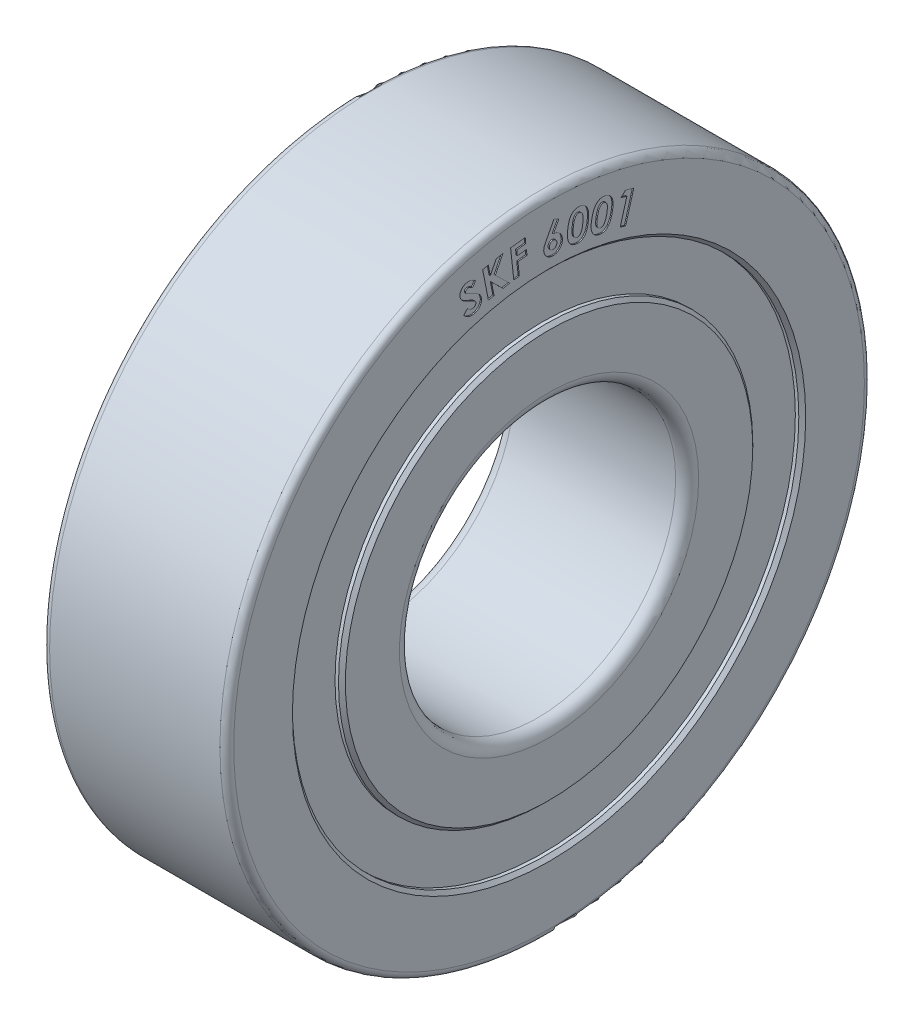
from build123d import *

# Parameters (mm, degrees)
CIRPATTERN1_COUNT = 8
WRAP1_START       = -0.05
WRAP1_DEPTH       = 0.05
SEAL_START        = 0.2
SKETCH3_R         = 11
SKETCH3_R_2       = 9
SEAL_1_DEPTH      = 0.2
SKETCH4_R         = 11
SKETCH4_R_2       = 9
SEAL_2_DEPTH      = 0.2


# Read off the part's stored shape, not the designer's step: Wrap1
with BuildPart() as part:
    # Sketch1 → Revolve1 (revolve)
    with BuildSketch(Plane.XY, mode=Mode.PRIVATE) as revolve1_sk:
        with BuildLine():
            Line((-7.85, 11), (-5.732050808, 11))
            ThreePointArc((-5.732050808, 11), (-4, 12), (-2.267949192, 11))
            Line((-2.267949192, 11), (-0.15, 11))
            Line((-0.15, 11), (0, 11.15))
            Line((0, 11.15), (0, 13.7))
            ThreePointArc((0, 13.7), (-0.087867966, 13.912132034), (-0.3, 14))
            Line((-0.3, 14), (-7.7, 14))
            ThreePointArc((-7.7, 14), (-7.912132034, 13.912132034), (-8, 13.7))
            Line((-8, 13.7), (-8, 11.15))
            Line((-8, 11.15), (-7.85, 11))
        make_face()
        with BuildLine():
            Line((-0.5, 6), (-7.5, 6))
            ThreePointArc((-7.5, 6), (-7.853553391, 6.146446609), (-8, 6.5))
            Line((-8, 6.5), (-8, 8.85))
            Line((-8, 8.85), (-7.85, 9))
            Line((-7.85, 9), (-5.732050808, 9))
            ThreePointArc((-5.732050808, 9), (-4, 8), (-2.267949192, 9))
            Line((-2.267949192, 9), (-0.15, 9))
            Line((-0.15, 9), (0, 8.85))
            Line((0, 8.85), (0, 6.5))
            ThreePointArc((0, 6.5), (-0.146446609, 6.146446609), (-0.5, 6))
        make_face()
    revolve(revolve1_sk.sketch.rotate(Axis((0, 0, 0), (-1, 0, 0)), 90), axis=Axis((0, 0, 0), (-1, 0, 0)))

    # Wrap1 outline → Wrap1 (cut)
    # profile 1 of 7: a face of its own
    with BuildSketch(Plane(origin=(0, 0, 0), x_dir=(0, 0, -1), z_dir=(1, 0, 0)).offset(WRAP1_START)):
        with BuildLine():
            add(Edge.make_bspline(
                [(2.748804473, 11.929900559), (2.744677269, 11.909473995), (2.736642719, 11.869708999), (2.7228412, 11.812208162), (2.708060267, 11.758508541), (2.692244165, 11.708696105), (2.675278299, 11.662738201), (2.657506162, 11.620434838), (2.638182676, 11.582170519), (2.618048028, 11.547439873), (2.596809898, 11.516077046), (2.574913629, 11.487450216), (2.552566986, 11.461102248), (2.528959388, 11.437817371), (2.505156726, 11.416368371), (2.47994072, 11.398303002), (2.454420118, 11.382202977), (2.42794631, 11.36877269), (2.400378028, 11.358205709), (2.37198971, 11.34942776), (2.342313498, 11.343495278), (2.311566628, 11.339981138), (2.279631419, 11.33825645), (2.246562067, 11.339494921), (2.212360058, 11.342785873), (2.189406935, 11.346843389), (2.177710723, 11.348910975)],
                knots=[0, 0, 0, 0, 0.067556761, 0.131514743, 0.191666234, 0.248092773, 0.300893158, 0.350446785, 0.396762035, 0.43976822, 0.4805124, 0.519462807, 0.556580783, 0.592400083, 0.626895931, 0.660332015, 0.692817787, 0.724659652, 0.756381904, 0.788432018, 0.820884861, 0.854325682, 0.888700784, 0.924459228, 0.961506724, 1, 1, 1, 1], degree=3))
            add(Edge.make_bspline(
                [(2.427450307, 12.683025559), (2.438779746, 12.68068703), (2.461116007, 12.676076565), (2.493364045, 12.666178446), (2.524283657, 12.655138562), (2.553510807, 12.641889359), (2.580956851, 12.626298911), (2.607038322, 12.609266501), (2.631323027, 12.590071287), (2.654167957, 12.569284068), (2.674919618, 12.546158387), (2.694397884, 12.521488946), (2.711537126, 12.494429627), (2.726956666, 12.465565156), (2.740150801, 12.434539168), (2.751968482, 12.401826642), (2.761503624, 12.366964767), (2.769411787, 12.330039027), (2.775130142, 12.290550976), (2.778441639, 12.248104797), (2.77939688, 12.202639384), (2.778014873, 12.153977975), (2.774302118, 12.102291235), (2.768315658, 12.047464984), (2.759573924, 11.989665569), (2.752461643, 11.950196003), (2.748804473, 11.929900559)],
                knots=[0, 0, 0, 0, 0.037321677, 0.073580581, 0.10877139, 0.143254524, 0.177002361, 0.210575258, 0.243703212, 0.276820499, 0.310144584, 0.343886603, 0.378164207, 0.413387352, 0.449407279, 0.486896874, 0.525579038, 0.565971964, 0.608729259, 0.654267994, 0.70331625, 0.755452753, 0.811350881, 0.870545288, 0.933433755, 1, 1, 1, 1], degree=3))
            add(Edge.make_bspline(
                [(2.060523223, 12.574952642), (2.073267377, 12.586747628), (2.098254401, 12.609873652), (2.139815389, 12.638256927), (2.183090722, 12.661065862), (2.228525138, 12.677430066), (2.275720749, 12.688394868), (2.324841477, 12.692497776), (2.375825234, 12.691457057), (2.409959866, 12.685882129), (2.427450307, 12.683025559)],
                knots=[0, 0, 0, 0, 0.130397068, 0.255665051, 0.377093545, 0.497247437, 0.61772522, 0.740265718, 0.866913249, 1, 1, 1, 1], degree=3))
            add(Edge.make_bspline(
                [(1.85531489, 12.089275559), (1.861058545, 12.117368385), (1.87213774, 12.171557902), (1.892131436, 12.249048331), (1.914514763, 12.319800051), (1.938827046, 12.384104361), (1.965460548, 12.441751657), (1.99446574, 12.492679198), (2.025442506, 12.537255647), (2.049117842, 12.562696662), (2.060523223, 12.574952642)],
                knots=[0, 0, 0, 0, 0.160955549, 0.310474406, 0.449028249, 0.577362618, 0.696182581, 0.80510359, 0.906110405, 1, 1, 1, 1], degree=3))
            add(Edge.make_bspline(
                [(2.177710723, 11.348910975), (2.166042339, 11.351362589), (2.143133598, 11.356175886), (2.109985284, 11.365871531), (2.078721413, 11.377389452), (2.049057492, 11.390283914), (2.021556446, 11.405462736), (1.995678909, 11.422211199), (1.971852757, 11.441009946), (1.949444383, 11.46135987), (1.929171269, 11.483869891), (1.910588438, 11.508151765), (1.893953921, 11.534378122), (1.878688419, 11.562301458), (1.865564567, 11.592366403), (1.853765083, 11.624147761), (1.843890091, 11.657916258), (1.835776104, 11.693727551), (1.829715679, 11.732163967), (1.826192068, 11.7736679), (1.82499012, 11.81843855), (1.826021525, 11.866419065), (1.829848001, 11.917580155), (1.835890849, 11.971945281), (1.844161408, 12.029645649), (1.851520264, 12.068988335), (1.85531489, 12.089275559)],
                knots=[0, 0, 0, 0, 0.038936398, 0.076444508, 0.112685815, 0.147723571, 0.181985153, 0.215173931, 0.248299663, 0.281011407, 0.313932628, 0.347109291, 0.380774315, 0.415284914, 0.450956019, 0.487827446, 0.525959504, 0.565788057, 0.607697029, 0.652956047, 0.701747399, 0.753933086, 0.809650651, 0.869270551, 0.9325888, 1, 1, 1, 1], degree=3))
        make_face()
        with BuildLine():
            add(Edge.make_bspline(
                [(2.095679473, 12.037452642), (2.092155863, 12.018117557), (2.085394307, 11.981014914), (2.077858333, 11.927245134), (2.072644413, 11.877826086), (2.070713172, 11.832707831), (2.070466798, 11.791880408), (2.074064147, 11.755342781), (2.079311233, 11.722840555), (2.088168112, 11.694556007), (2.098874475, 11.669775963), (2.111476136, 11.647998968), (2.125558438, 11.628797273), (2.141293481, 11.612242199), (2.158540239, 11.598232411), (2.177575762, 11.587264068), (2.198125111, 11.57867073), (2.212715455, 11.575346431), (2.22015864, 11.573650559)],
                knots=[0, 0, 0, 0, 0.110463374, 0.211971297, 0.305143348, 0.389648137, 0.465769208, 0.534375464, 0.595825616, 0.650462447, 0.700502447, 0.747286732, 0.791593156, 0.83404442, 0.875347217, 0.916019755, 0.957157935, 1, 1, 1, 1], degree=3))
            add(Edge.make_bspline(
                [(2.389429473, 12.452556809), (2.379382409, 12.453942807), (2.359581409, 12.456674367), (2.32952721, 12.454755701), (2.300376906, 12.44729484), (2.27191006, 12.434583396), (2.244362022, 12.415414506), (2.219173183, 12.387983588), (2.195262453, 12.353498998), (2.177134566, 12.31944249), (2.163432037, 12.287999576), (2.15267897, 12.260982808), (2.142591096, 12.230860357), (2.132851275, 12.197790964), (2.122793862, 12.161928849), (2.113676735, 12.123009788), (2.104053711, 12.081340684), (2.098532328, 12.052404), (2.095679473, 12.037452642)],
                knots=[0, 0, 0, 0, 0.053669381, 0.105772925, 0.15845655, 0.212426977, 0.270261805, 0.335040509, 0.408710237, 0.492306677, 0.539080977, 0.590527972, 0.646412843, 0.707419901, 0.773292821, 0.843837351, 0.919311979, 1, 1, 1, 1], degree=3))
            add(Edge.make_bspline(
                [(2.507398223, 11.973650559), (2.511125856, 11.993675073), (2.518286901, 12.032143571), (2.525908464, 12.087961125), (2.531669319, 12.139253938), (2.534376028, 12.186114263), (2.534215846, 12.228390735), (2.531476614, 12.266185496), (2.52623689, 12.299541097), (2.518202497, 12.328759616), (2.507385581, 12.353953925), (2.495890037, 12.376610583), (2.482290301, 12.396387501), (2.466739725, 12.41305561), (2.450014467, 12.427524916), (2.43123799, 12.438646412), (2.411082704, 12.447547981), (2.396706332, 12.450873525), (2.389429473, 12.452556809)],
                knots=[0, 0, 0, 0, 0.111971417, 0.215104953, 0.309658952, 0.395699219, 0.473017708, 0.541944171, 0.603850864, 0.658395027, 0.708030642, 0.754354911, 0.797911765, 0.839455803, 0.879420914, 0.919036828, 0.959019034, 1, 1, 1, 1], degree=3))
            add(Edge.make_bspline(
                [(2.376669057, 11.633546392), (2.383647939, 11.64198908), (2.398262976, 11.659669589), (2.416963509, 11.690635135), (2.435084667, 11.726005134), (2.45167591, 11.766360164), (2.46770801, 11.811316154), (2.482027399, 11.861138514), (2.495668425, 11.915671222), (2.503387146, 11.953824163), (2.507398223, 11.973650559)],
                knots=[0, 0, 0, 0, 0.089163387, 0.186724191, 0.293980945, 0.412886508, 0.541992877, 0.682802955, 0.835166732, 1, 1, 1, 1], degree=3))
            add(Edge.make_bspline(
                [(2.22015864, 11.573650559), (2.227343689, 11.572468791), (2.241480402, 11.570143643), (2.262816084, 11.570604012), (2.283509414, 11.573650997), (2.303562492, 11.579791118), (2.323061292, 11.588721833), (2.341798307, 11.600847154), (2.359944878, 11.615833167), (2.370975779, 11.627516421), (2.376669057, 11.633546392)],
                knots=[0, 0, 0, 0, 0.123876656, 0.243729564, 0.361954997, 0.479437451, 0.599927928, 0.726340973, 0.858758881, 1, 1, 1, 1], degree=3))
        make_face(mode=Mode.SUBTRACT)
    # profile 2 of 7: a face of its own
    with BuildSketch(Plane(origin=(0, 0, 0), x_dir=(0, 0, -1), z_dir=(1, 0, 0)).offset(WRAP1_START)):
        with BuildLine():
            add(Edge.make_bspline(
                [(1.708998575, 12.121430648), (1.706693025, 12.100755473), (1.702218666, 12.060631347), (1.69362829, 12.002334378), (1.683524636, 11.947787962), (1.672125392, 11.896950656), (1.659414515, 11.8498046), (1.645153103, 11.80642771), (1.629635244, 11.766584568), (1.612302202, 11.730521171), (1.593937689, 11.697595717), (1.574961368, 11.667086567), (1.554574196, 11.639308791), (1.533553222, 11.613734692), (1.51164804, 11.590525736), (1.488345999, 11.570301498), (1.464318016, 11.552163217), (1.439292716, 11.53642551), (1.412894138, 11.523320906), (1.385372939, 11.512417307), (1.356464355, 11.503704692), (1.326193696, 11.497605382), (1.294619389, 11.493360492), (1.261711784, 11.491612387), (1.22752081, 11.492143685), (1.204389484, 11.494120416), (1.192592325, 11.495128565)],
                knots=[0, 0, 0, 0, 0.067675635, 0.131337489, 0.191656317, 0.248109531, 0.300792029, 0.350445326, 0.39659394, 0.43979341, 0.480498758, 0.519204562, 0.556598277, 0.592503559, 0.626859461, 0.660279893, 0.692756327, 0.724726629, 0.756300331, 0.788499315, 0.820931517, 0.854384148, 0.888852451, 0.924490196, 0.961489402, 1, 1, 1, 1], degree=3))
            add(Edge.make_bspline(
                [(1.324883992, 12.840961898), (1.336363918, 12.839541899), (1.358913128, 12.836752694), (1.391900209, 12.830186734), (1.423432492, 12.821662184), (1.453539324, 12.810908777), (1.482229171, 12.798199752), (1.509459178, 12.783246196), (1.535204073, 12.766316282), (1.559589011, 12.747525765), (1.582295761, 12.726586174), (1.603541213, 12.703567556), (1.62294267, 12.678312992), (1.640867109, 12.651065732), (1.656632983, 12.621497562), (1.670967117, 12.589916882), (1.68375278, 12.556283291), (1.694749803, 12.520281358), (1.703913978, 12.481593928), (1.710770125, 12.439724413), (1.716075686, 12.394725197), (1.718751127, 12.346380157), (1.719503064, 12.294776234), (1.718114261, 12.239880754), (1.714750576, 12.181685715), (1.71095318, 12.141906108), (1.708998575, 12.121430648)],
                knots=[0, 0, 0, 0, 0.037477146, 0.073613716, 0.108895956, 0.143241655, 0.177117549, 0.210480286, 0.243796735, 0.276883171, 0.310131854, 0.343778032, 0.378270881, 0.413226375, 0.449350898, 0.486741367, 0.5255607, 0.565871183, 0.608654083, 0.654300741, 0.703292252, 0.755427313, 0.811133935, 0.870507914, 0.933347507, 1, 1, 1, 1], degree=3))
            add(Edge.make_bspline(
                [(0.969936075, 12.701899398), (0.98162567, 12.71469243), (1.004511497, 12.73973856), (1.043224056, 12.771748394), (1.084284645, 12.797903373), (1.127660196, 12.818644064), (1.17375816, 12.832855938), (1.22207355, 12.84179989), (1.272911952, 12.844654976), (1.307273088, 12.84221331), (1.324883992, 12.840961898)],
                knots=[0, 0, 0, 0, 0.130595614, 0.25567939, 0.377561947, 0.497064449, 0.617177095, 0.740340377, 0.866918238, 1, 1, 1, 1], degree=3))
            add(Edge.make_bspline(
                [(0.808217325, 12.201899398), (0.811424077, 12.230233367), (0.817621136, 12.284988866), (0.830893962, 12.363658314), (0.846946315, 12.435906969), (0.865565291, 12.501819657), (0.886974648, 12.561401211), (0.911505905, 12.614420504), (0.938251018, 12.66152255), (0.959623963, 12.688758484), (0.969936075, 12.701899398)],
                knots=[0, 0, 0, 0, 0.160580499, 0.310322413, 0.449101861, 0.57723776, 0.695866105, 0.805239258, 0.906030977, 1, 1, 1, 1], degree=3))
            add(Edge.make_bspline(
                [(1.192592325, 11.495128565), (1.180765277, 11.496545311), (1.157609989, 11.499319052), (1.123839976, 11.505878717), (1.091777099, 11.514381826), (1.061448755, 11.525160361), (1.03272859, 11.537678944), (1.005507696, 11.551901504), (0.980204062, 11.568489608), (0.956322381, 11.586733329), (0.934145251, 11.607166376), (0.913473708, 11.62955381), (0.894729736, 11.654302873), (0.877290016, 11.680817161), (0.8613368, 11.709348786), (0.847022447, 11.739908866), (0.834286398, 11.772545689), (0.823021659, 11.807375625), (0.813417557, 11.844974816), (0.806743055, 11.885954045), (0.801353238, 11.930248383), (0.798819014, 11.977995239), (0.797606271, 12.029071119), (0.799146143, 12.083623167), (0.802455838, 12.141644177), (0.806259496, 12.181423886), (0.808217325, 12.201899398)],
                knots=[0, 0, 0, 0, 0.039033166, 0.076420099, 0.112654628, 0.14766074, 0.18180876, 0.215282768, 0.248192137, 0.280858303, 0.313682694, 0.346909102, 0.380598867, 0.415321693, 0.450861422, 0.487645864, 0.525846769, 0.565617541, 0.607574469, 0.652901019, 0.701604251, 0.753766731, 0.809545697, 0.869028922, 0.932586237, 1, 1, 1, 1], degree=3))
        make_face()
        with BuildLine():
            add(Edge.make_bspline(
                [(1.051446492, 12.171691065), (1.049534267, 12.152173365), (1.04586766, 12.114749044), (1.043387231, 12.060691906), (1.042781577, 12.011268436), (1.044054509, 11.966210528), (1.048244645, 11.925681308), (1.054302048, 11.889498272), (1.062662859, 11.857806275), (1.073774737, 11.830543654), (1.086758609, 11.807000061), (1.101065555, 11.78647224), (1.116438266, 11.768376272), (1.133589141, 11.753497736), (1.151915529, 11.740975489), (1.171823416, 11.731678152), (1.193020513, 11.724936364), (1.207739353, 11.722787412), (1.215248575, 11.721691065)],
                knots=[0, 0, 0, 0, 0.110585456, 0.212042694, 0.305064371, 0.389320021, 0.466092123, 0.534665574, 0.596065927, 0.650521711, 0.700259724, 0.747384864, 0.79145892, 0.833782564, 0.875059815, 0.916229508, 0.957262168, 1, 1, 1, 1], degree=3))
            add(Edge.make_bspline(
                [(1.306915242, 12.608930648), (1.296837638, 12.609566973), (1.276921778, 12.610824511), (1.247316202, 12.606124032), (1.219033216, 12.596332356), (1.196820819, 12.583906063), (1.179970514, 12.571228758), (1.167685973, 12.559756304), (1.156256619, 12.546208813), (1.144927977, 12.531108869), (1.134456716, 12.51390325), (1.124142787, 12.495023219), (1.114632772, 12.474174102), (1.10542569, 12.451350455), (1.096801707, 12.426149209), (1.088780517, 12.398239068), (1.081311713, 12.367555026), (1.07421762, 12.33395607), (1.067819796, 12.297460819), (1.061928774, 12.258017185), (1.056021199, 12.215865455), (1.053002852, 12.186719622), (1.051446492, 12.171691065)],
                knots=[0, 0, 0, 0, 0.053599206, 0.105925415, 0.158221034, 0.212193123, 0.240554404, 0.270292794, 0.301405627, 0.334755873, 0.370645237, 0.408468115, 0.449181549, 0.492497555, 0.539387441, 0.590844039, 0.646971048, 0.70739627, 0.773541061, 0.844093584, 0.919609485, 1, 1, 1, 1], degree=3))
            add(Edge.make_bspline(
                [(1.465769408, 12.143826482), (1.467767348, 12.16403839), (1.471603838, 12.202849776), (1.474337763, 12.258902562), (1.475196733, 12.310232245), (1.474212483, 12.356935534), (1.470233708, 12.39892937), (1.464533311, 12.436255279), (1.456289265, 12.468932288), (1.445588421, 12.497117745), (1.432820726, 12.52136992), (1.419043302, 12.542631324), (1.403903114, 12.561152059), (1.387142747, 12.576518215), (1.369226934, 12.589334539), (1.349761982, 12.599107126), (1.328769445, 12.605585638), (1.314243303, 12.607809013), (1.306915242, 12.608930648)],
                knots=[0, 0, 0, 0, 0.112035084, 0.215132422, 0.309485896, 0.395241738, 0.472677923, 0.542040204, 0.603368831, 0.658243724, 0.707938283, 0.754294834, 0.797829626, 0.839515601, 0.879376332, 0.918997571, 0.95913638, 1, 1, 1, 1], degree=3))
            add(Edge.make_bspline(
                [(1.365508992, 11.794868148), (1.371722043, 11.803848218), (1.384702382, 11.822609424), (1.400581839, 11.855022567), (1.41540892, 11.891731822), (1.428535135, 11.933215513), (1.440121213, 11.97925247), (1.450640768, 12.02986611), (1.458995312, 12.085280652), (1.463457641, 12.123846793), (1.465769408, 12.143826482)],
                knots=[0, 0, 0, 0, 0.089200476, 0.186358086, 0.294332024, 0.412879711, 0.541851485, 0.682480032, 0.835504676, 1, 1, 1, 1], degree=3))
            add(Edge.make_bspline(
                [(1.215248575, 11.721691065), (1.2225377, 11.721251337), (1.236790933, 11.720391489), (1.257965113, 11.722166099), (1.278212334, 11.727225441), (1.297529802, 11.735122639), (1.316131638, 11.745645439), (1.333459816, 11.75944233), (1.35045473, 11.775645883), (1.360369532, 11.788305751), (1.365508992, 11.794868148)],
                knots=[0, 0, 0, 0, 0.124715865, 0.243870738, 0.361547563, 0.480026125, 0.599651221, 0.725491783, 0.857705304, 1, 1, 1, 1], degree=3))
        make_face(mode=Mode.SUBTRACT)
    # profile 3 of 7: a face of its own
    with BuildSketch(Plane(origin=(0, 0, 0), x_dir=(0, 0, -1), z_dir=(1, 0, 0)).offset(WRAP1_START)):
        with BuildLine():
            add(Edge.make_bspline(
                [(0.1901272, 12.370454246), (0.20360597, 12.36994974), (0.230087376, 12.368958551), (0.268981012, 12.362730936), (0.306279653, 12.353226481), (0.342018549, 12.339739767), (0.376198346, 12.322844936), (0.408789817, 12.302090946), (0.439443984, 12.277400788), (0.468558513, 12.249768827), (0.494789175, 12.219191453), (0.518299684, 12.186928658), (0.537534149, 12.152449049), (0.553610706, 12.116537247), (0.565514428, 12.078648349), (0.574155921, 12.039188043), (0.579218703, 11.997845157), (0.5795446, 11.969686995), (0.579710533, 11.955350079)],
                knots=[0, 0, 0, 0, 0.063712171, 0.125173721, 0.185786933, 0.245390216, 0.305400352, 0.365733716, 0.4276416, 0.491204266, 0.555209138, 0.617843092, 0.679583468, 0.741498151, 0.80353103, 0.866957115, 0.932260329, 1, 1, 1, 1], degree=3))
            Line((0.1901272, 12.370454246), (0.4213772, 12.807433412))
            Line((0.4213772, 12.807433412), (0.2135647, 12.914725079))
            Line((0.2135647, 12.914725079), (-0.126539467, 12.268110496))
            add(Edge.make_bspline(
                [(-0.231487383, 11.962641746), (-0.231109141, 11.972634494), (-0.23035038, 11.992680094), (-0.226600564, 12.022803073), (-0.220663643, 12.05293355), (-0.21354997, 12.078290215), (-0.20634354, 12.099671085), (-0.199243516, 12.117766202), (-0.19089537, 12.137941633), (-0.180946951, 12.160062163), (-0.169479399, 12.184281887), (-0.156451159, 12.210453855), (-0.142116743, 12.238706829), (-0.131865494, 12.258057087), (-0.126539467, 12.268110496)],
                knots=[0, 0, 0, 0, 0.091871355, 0.184295283, 0.278641223, 0.373873502, 0.426097173, 0.485953161, 0.552477122, 0.626757907, 0.708837919, 0.798748528, 0.895439984, 1, 1, 1, 1], degree=3))
            add(Edge.make_bspline(
                [(0.1713772, 11.556912579), (0.157116448, 11.557401199), (0.12897996, 11.558365247), (0.08783344, 11.564838832), (0.048497665, 11.574579097), (0.011167635, 11.588594937), (-0.024288637, 11.606285761), (-0.057820439, 11.627859416), (-0.089564889, 11.65299049), (-0.118823256, 11.681723425), (-0.145559746, 11.712697831), (-0.168633441, 11.745385308), (-0.188830161, 11.778756016), (-0.204582587, 11.813541465), (-0.217087308, 11.849243674), (-0.225482181, 11.886115791), (-0.231072964, 11.924014053), (-0.231348401, 11.949687323), (-0.231487383, 11.962641746)],
                knots=[0, 0, 0, 0, 0.06734365, 0.132869139, 0.196314253, 0.258459609, 0.320803476, 0.383131162, 0.446460908, 0.511699705, 0.576540449, 0.639456057, 0.700491865, 0.760485912, 0.819483933, 0.878858307, 0.938873366, 1, 1, 1, 1], degree=3))
            add(Edge.make_bspline(
                [(0.579710533, 11.955350079), (0.579194669, 11.941527683), (0.578180835, 11.914362363), (0.572120933, 11.874451704), (0.562065919, 11.836331849), (0.548892305, 11.799551758), (0.531524041, 11.764678638), (0.510848247, 11.731244281), (0.486238787, 11.699720154), (0.458235802, 11.670265344), (0.427809466, 11.643439333), (0.395645345, 11.619750517), (0.361921004, 11.599962985), (0.326799711, 11.583480285), (0.289897813, 11.571477288), (0.251702681, 11.562408482), (0.211962675, 11.55744205), (0.185018492, 11.557090541), (0.1713772, 11.556912579)],
                knots=[0, 0, 0, 0, 0.065324149, 0.128382331, 0.190264872, 0.251382752, 0.31265323, 0.374003292, 0.436853007, 0.501266752, 0.565784895, 0.628301772, 0.689716249, 0.75027965, 0.811244551, 0.872734322, 0.935567973, 1, 1, 1, 1], degree=3))
        make_face()
        with BuildLine():
            add(Edge.make_bspline(
                [(0.009398033, 11.966027162), (0.009782386, 11.953987383), (0.010531955, 11.930507319), (0.019803114, 11.896803388), (0.03485958, 11.866013206), (0.055665134, 11.838861311), (0.080525202, 11.816439937), (0.108236541, 11.799747249), (0.138289813, 11.789367213), (0.159231424, 11.787875022), (0.1698147, 11.787120912)],
                knots=[0, 0, 0, 0, 0.135186379, 0.263641458, 0.389922987, 0.518897229, 0.646206449, 0.764506131, 0.880988305, 1, 1, 1, 1], degree=3))
            add(Edge.make_bspline(
                [(0.173460533, 12.137902162), (0.162362571, 12.137546414), (0.140709196, 12.136852309), (0.109779698, 12.127125738), (0.081541237, 12.111762684), (0.056738706, 12.090371951), (0.036118453, 12.06429782), (0.02076467, 12.034456291), (0.011420407, 12.001207611), (0.010085153, 11.977980034), (0.009398033, 11.966027162)],
                knots=[0, 0, 0, 0, 0.125199432, 0.244278191, 0.363027997, 0.487107669, 0.61235338, 0.737181965, 0.864754278, 1, 1, 1, 1], degree=3))
            add(Edge.make_bspline(
                [(0.338825117, 11.961860496), (0.338385559, 11.973884896), (0.337533007, 11.997207007), (0.32914286, 12.030852776), (0.313878039, 12.06100441), (0.293242999, 12.087466011), (0.268436271, 12.109854121), (0.239478962, 12.125904531), (0.207450499, 12.136022372), (0.184995291, 12.137264241), (0.173460533, 12.137902162)],
                knots=[0, 0, 0, 0, 0.133531098, 0.258992296, 0.381998195, 0.506509268, 0.63025499, 0.750801937, 0.871992319, 1, 1, 1, 1], degree=3))
            add(Edge.make_bspline(
                [(0.1698147, 11.787120912), (0.180897724, 11.787632962), (0.202657332, 11.788638282), (0.234177594, 11.797798016), (0.263043595, 11.813611355), (0.288920896, 11.835210274), (0.310716977, 11.861545171), (0.327044176, 11.891912116), (0.336905238, 11.925844918), (0.338173789, 11.949642052), (0.338825117, 11.961860496)],
                knots=[0, 0, 0, 0, 0.122637376, 0.24077734, 0.360016813, 0.485042179, 0.612163467, 0.736550565, 0.864734041, 1, 1, 1, 1], degree=3))
        make_face(mode=Mode.SUBTRACT)
    # profile 4 of 7: a face of its own
    with BuildSketch(Plane(origin=(0, 0, 0), x_dir=(0, 0, -1), z_dir=(1, 0, 0)).offset(WRAP1_START)):
        with BuildLine():
            add(Edge.make_bspline(
                [(-3.322861192, 12.103271093), (-3.33331933, 12.111272222), (-3.353444189, 12.126668998), (-3.384537721, 12.145822762), (-3.414304908, 12.161455715), (-3.443026463, 12.173126691), (-3.470844017, 12.180658139), (-3.497668507, 12.183765968), (-3.523591566, 12.183384933), (-3.540005436, 12.179440331), (-3.548121609, 12.177489843)],
                knots=[0, 0, 0, 0, 0.160452189, 0.308762181, 0.444616019, 0.570003598, 0.686037548, 0.794734634, 0.898502362, 1, 1, 1, 1], degree=3))
            Line((-3.322861192, 12.103271093), (-3.192652859, 12.309260676))
            add(Edge.make_bspline(
                [(-3.610621609, 12.405094009), (-3.595160906, 12.409053939), (-3.564293926, 12.416959858), (-3.516715167, 12.421616958), (-3.468749889, 12.420850485), (-3.42853033, 12.415433855), (-3.395722364, 12.407862121), (-3.369832483, 12.399930954), (-3.34293148, 12.390003858), (-3.314726256, 12.378297947), (-3.285820222, 12.363792793), (-3.2555206, 12.347697033), (-3.224253576, 12.329440267), (-3.203370999, 12.316105068), (-3.192652859, 12.309260676)],
                knots=[0, 0, 0, 0, 0.107715795, 0.215052406, 0.321823356, 0.431325877, 0.488525103, 0.549203613, 0.614151939, 0.682240005, 0.755430231, 0.832581981, 0.91407143, 1, 1, 1, 1], degree=3))
            add(Edge.make_bspline(
                [(-3.861142442, 11.991031509), (-3.863859424, 12.001752356), (-3.86922561, 12.022926609), (-3.873713923, 12.055036692), (-3.874457151, 12.086913984), (-3.871856071, 12.118519077), (-3.865809207, 12.149941551), (-3.856349613, 12.18108272), (-3.843480113, 12.211937314), (-3.827398196, 12.242157647), (-3.808643917, 12.271128896), (-3.787115359, 12.29785866), (-3.76339049, 12.32209507), (-3.737440521, 12.344007088), (-3.708884639, 12.362908503), (-3.678291992, 12.379583666), (-3.645559844, 12.394230234), (-3.622426339, 12.401423419), (-3.610621609, 12.405094009)],
                knots=[0, 0, 0, 0, 0.061581059, 0.121625931, 0.180156225, 0.238868022, 0.297953025, 0.35807379, 0.419859564, 0.483890524, 0.548539348, 0.611826452, 0.674746693, 0.737219363, 0.800657779, 0.865147253, 0.931186379, 1, 1, 1, 1], degree=3))
            add(Edge.make_bspline(
                [(-3.412704942, 11.648583593), (-3.43279849, 11.657170427), (-3.471502511, 11.673710315), (-3.526466541, 11.698981574), (-3.576516668, 11.722867659), (-3.621151557, 11.746049375), (-3.660877787, 11.767800909), (-3.695334038, 11.788581589), (-3.724635678, 11.808275315), (-3.749206982, 11.827315903), (-3.769922526, 11.846466223), (-3.788871603, 11.865282167), (-3.805390744, 11.885189927), (-3.820410815, 11.905263689), (-3.833445208, 11.925910017), (-3.844754507, 11.946989778), (-3.853883487, 11.968768179), (-3.858725184, 11.983617741), (-3.861142442, 11.991031509)],
                knots=[0, 0, 0, 0, 0.112425141, 0.216552341, 0.311239944, 0.397736141, 0.475301552, 0.544239725, 0.60469235, 0.656870291, 0.703979134, 0.749773892, 0.794150591, 0.836939032, 0.878696388, 0.91965549, 0.959887333, 1, 1, 1, 1], degree=3))
            add(Edge.make_bspline(
                [(-3.181194525, 11.483739843), (-3.183617759, 11.49072236), (-3.188568313, 11.504987324), (-3.201317779, 11.524490794), (-3.217459134, 11.54305381), (-3.234221135, 11.557203821), (-3.250377027, 11.568512359), (-3.265501095, 11.577753733), (-3.28327904, 11.587957239), (-3.303770608, 11.59882432), (-3.327088459, 11.610277557), (-3.353145274, 11.622493706), (-3.381937091, 11.635501771), (-3.402183797, 11.64411023), (-3.412704942, 11.648583593)],
                knots=[0, 0, 0, 0, 0.075474737, 0.154191428, 0.236767433, 0.32696134, 0.378035398, 0.438746485, 0.508463052, 0.588034217, 0.676331517, 0.774600191, 0.882871603, 1, 1, 1, 1], degree=3))
            add(Edge.make_bspline(
                [(-3.291090359, 11.324104426), (-3.281397362, 11.327323022), (-3.262527669, 11.333588775), (-3.237229012, 11.348473332), (-3.215690596, 11.36700328), (-3.198440468, 11.388737015), (-3.185658227, 11.412186734), (-3.178021442, 11.436226501), (-3.176147545, 11.460509635), (-3.179505772, 11.47596686), (-3.181194525, 11.483739843)],
                knots=[0, 0, 0, 0, 0.142632623, 0.277667871, 0.407741651, 0.538291229, 0.663866693, 0.779547792, 0.889141085, 1, 1, 1, 1], degree=3))
            add(Edge.make_bspline(
                [(-3.545517442, 11.429312759), (-3.534325452, 11.418436058), (-3.512939491, 11.397652559), (-3.479362606, 11.370913463), (-3.446562393, 11.349220394), (-3.414134761, 11.333125503), (-3.382334769, 11.322347663), (-3.351119963, 11.317360745), (-3.320433532, 11.317181972), (-3.300846483, 11.321802823), (-3.291090359, 11.324104426)],
                knots=[0, 0, 0, 0, 0.161890228, 0.309344296, 0.44478239, 0.569282343, 0.684095854, 0.791773793, 0.896284489, 1, 1, 1, 1], degree=3))
            Line((-3.545517442, 11.429312759), (-3.709579942, 11.251448176))
            add(Edge.make_bspline(
                [(-3.230673692, 11.097541926), (-3.241668338, 11.094645022), (-3.263348172, 11.088932753), (-3.295932102, 11.082537934), (-3.328076612, 11.079071006), (-3.359656308, 11.077230495), (-3.390806528, 11.078530492), (-3.421506481, 11.081360773), (-3.451634752, 11.087404131), (-3.481426885, 11.095003115), (-3.510804464, 11.105649602), (-3.539988231, 11.11865237), (-3.568947712, 11.134370497), (-3.597650945, 11.152660207), (-3.625984061, 11.173589835), (-3.654298601, 11.19690176), (-3.682397318, 11.222891237), (-3.700393962, 11.241797765), (-3.709579942, 11.251448176)],
                knots=[0, 0, 0, 0, 0.063894384, 0.125990374, 0.186384248, 0.245487488, 0.303575273, 0.361439322, 0.418560287, 0.476069516, 0.534089656, 0.593927275, 0.655484327, 0.719093113, 0.785054931, 0.853328787, 0.925134991, 1, 1, 1, 1], degree=3))
            add(Edge.make_bspline(
                [(-2.951767442, 11.561344009), (-2.948486836, 11.54872204), (-2.942048053, 11.523949134), (-2.936680346, 11.486511054), (-2.934678281, 11.449883778), (-2.936788848, 11.41389665), (-2.942818742, 11.378530155), (-2.952740663, 11.3438789), (-2.966515171, 11.310013772), (-2.983501415, 11.27710777), (-3.004125385, 11.245952611), (-3.027574852, 11.216814713), (-3.054307847, 11.1904583), (-3.08396838, 11.166684551), (-3.116347381, 11.145231508), (-3.151704459, 11.126518402), (-3.18990948, 11.11015705), (-3.216872159, 11.101813026), (-3.230673692, 11.097541926)],
                knots=[0, 0, 0, 0, 0.064398246, 0.126393247, 0.186518606, 0.245382258, 0.304122321, 0.363452954, 0.423111384, 0.484502487, 0.546126903, 0.607422031, 0.668992684, 0.731224647, 0.794989827, 0.860616272, 0.928652898, 1, 1, 1, 1], degree=3))
            add(Edge.make_bspline(
                [(-3.166350775, 11.807437759), (-3.15163277, 11.798885436), (-3.123333235, 11.782441173), (-3.084816952, 11.755386063), (-3.051509793, 11.727778645), (-3.023693637, 11.698714936), (-3.000356806, 11.667854423), (-2.980486498, 11.634899104), (-2.96384782, 11.599304464), (-2.955833235, 11.574120048), (-2.951767442, 11.561344009)],
                knots=[0, 0, 0, 0, 0.151886084, 0.292044021, 0.419626732, 0.537455658, 0.650273809, 0.764288301, 0.880423604, 1, 1, 1, 1], degree=3))
            add(Edge.make_bspline(
                [(-3.372079942, 11.902750259), (-3.35872, 11.896829555), (-3.333386079, 11.885602363), (-3.297274582, 11.869928681), (-3.265678636, 11.855027693), (-3.237638353, 11.84284079), (-3.214083725, 11.831502997), (-3.194464633, 11.822222554), (-3.178996643, 11.814424992), (-3.170159064, 11.809541956), (-3.166350775, 11.807437759)],
                knots=[0, 0, 0, 0, 0.193302823, 0.366552366, 0.520692477, 0.655351976, 0.770921412, 0.866447655, 0.942449634, 1, 1, 1, 1], degree=3))
            add(Edge.make_bspline(
                [(-3.591871609, 12.012385676), (-3.587910948, 12.009644049), (-3.57873362, 12.003291367), (-3.562180874, 11.993842182), (-3.541217273, 11.982632019), (-3.515960844, 11.969760177), (-3.486223975, 11.955357377), (-3.452150067, 11.939307493), (-3.413731834, 11.921239476), (-3.386427795, 11.909119251), (-3.372079942, 11.902750259)],
                knots=[0, 0, 0, 0, 0.05875462, 0.136141539, 0.232342392, 0.34887373, 0.481987915, 0.635498956, 0.808460306, 1, 1, 1, 1], degree=3))
            add(Edge.make_bspline(
                [(-3.630413275, 12.065250259), (-3.62871792, 12.060114991), (-3.625316231, 12.0498112), (-3.616287045, 12.036111806), (-3.605529838, 12.023100987), (-3.596538322, 12.01604686), (-3.591871609, 12.012385676)],
                knots=[0, 0, 0, 0, 0.242587697, 0.486746371, 0.733614715, 1, 1, 1, 1], degree=3))
            add(Edge.make_bspline(
                [(-3.548121609, 12.177489843), (-3.555500791, 12.175021338), (-3.569668026, 12.170282074), (-3.588914034, 12.15978487), (-3.604710215, 12.146206342), (-3.617438634, 12.130771307), (-3.626450812, 12.114141452), (-3.632287265, 12.097641651), (-3.633834913, 12.081002475), (-3.631557583, 12.070518317), (-3.630413275, 12.065250259)],
                knots=[0, 0, 0, 0, 0.151633623, 0.291120223, 0.424478642, 0.555668838, 0.679202752, 0.791665545, 0.895316535, 1, 1, 1, 1], degree=3))
        make_face()
    # profile 5 of 7: a face of its own
    with BuildSketch(Plane(origin=(0, 0, 0), x_dir=(0, 0, -1), z_dir=(1, 0, 0)).offset(WRAP1_START)):
        Polygon((3.324636277, 11.102737757), (3.679323777, 12.34778984), (3.324636277, 12.448831507), (3.12437586, 12.265237757), (3.380886277, 12.192060673), (3.089480027, 11.16966484), align=None)
    # profile 6 of 7: a face of its own
    with BuildSketch(Plane(origin=(0, 0, 0), x_dir=(0, 0, -1), z_dir=(1, 0, 0)).offset(WRAP1_START)):
        Polygon((-1.01046971, 12.605964335), (-1.03625096, 12.843724752), (-1.671928043, 12.774453918), (-1.532865543, 11.493464335), (-1.29171971, 11.519766418), (-1.35421971, 12.096328918), (-0.95968846, 12.139297668), (-0.985209293, 12.373412252), (-1.379740543, 12.330443502), (-1.40500096, 12.562995585), align=None)
    # profile 7 of 7: a face of its own
    with BuildSketch(Plane(origin=(0, 0, 0), x_dir=(0, 0, -1), z_dir=(1, 0, 0)).offset(WRAP1_START)):
        Polygon((-2.554738023, 12.170489807), (-2.640415107, 12.606948141), (-2.88468594, 12.559031474), (-2.635727607, 11.290021057), (-2.391456773, 11.337937724), (-2.50187344, 11.901218974), (-2.000050523, 11.414760641), (-1.71359219, 11.471010641), (-2.33781094, 12.078562724), (-2.005519273, 12.731427307), (-2.29640469, 12.674396057), align=None)
    extrude(amount=WRAP1_DEPTH, mode=Mode.SUBTRACT)


with BuildPart() as body_2:
    # Sketch2 → Revolve2 (revolve)
    with BuildSketch(Plane.XY):
        with BuildLine():
            Line((-4, 12), (-4, 8))
            ThreePointArc((-4, 8), (-2, 10), (-4, 12))
        make_face()
    revolve(axis=Axis((-4, 12, 0), (0, -1, 0)))


with BuildPart() as cirpattern1_1:
    # CirPattern1: pattern copy
    add(body_2.part.rotate(Axis((0, 0, 0), (1, 0, 0)), 1 * 360 / CIRPATTERN1_COUNT))


with BuildPart() as cirpattern1_2:
    # CirPattern1: pattern copy
    add(body_2.part.rotate(Axis((0, 0, 0), (1, 0, 0)), 2 * 360 / CIRPATTERN1_COUNT))


with BuildPart() as cirpattern1_3:
    # CirPattern1: pattern copy
    add(body_2.part.rotate(Axis((0, 0, 0), (1, 0, 0)), 3 * 360 / CIRPATTERN1_COUNT))


with BuildPart() as cirpattern1_4:
    # CirPattern1: pattern copy
    add(body_2.part.rotate(Axis((0, 0, 0), (1, 0, 0)), 4 * 360 / CIRPATTERN1_COUNT))


with BuildPart() as cirpattern1_5:
    # CirPattern1: pattern copy
    add(body_2.part.rotate(Axis((0, 0, 0), (1, 0, 0)), 5 * 360 / CIRPATTERN1_COUNT))


with BuildPart() as cirpattern1_6:
    # CirPattern1: pattern copy
    add(body_2.part.rotate(Axis((0, 0, 0), (1, 0, 0)), 6 * 360 / CIRPATTERN1_COUNT))


with BuildPart() as cirpattern1_7:
    # CirPattern1: pattern copy
    add(body_2.part.rotate(Axis((0, 0, 0), (1, 0, 0)), 7 * 360 / CIRPATTERN1_COUNT))


with BuildPart() as body_10:
    # Sketch3 → Seal 1 (new body)
    with BuildSketch(Plane(origin=(-0.5, 0, 0), x_dir=(0, 0, -1), z_dir=(1, 0, 0)).offset(SEAL_START)):
        Circle(SKETCH3_R)
        Circle(SKETCH3_R_2, mode=Mode.SUBTRACT)
    extrude(amount=-SEAL_1_DEPTH)


with BuildPart() as body_11:
    # Sketch4 → Seal 2 (new body)
    with BuildSketch(Plane.ZY.offset(7.5)):
        Circle(SKETCH4_R)
        Circle(SKETCH4_R_2, mode=Mode.SUBTRACT)
    extrude(amount=SEAL_2_DEPTH)


solid = Compound([part.part, body_2.part, cirpattern1_1.part, cirpattern1_2.part, cirpattern1_3.part, cirpattern1_4.part, cirpattern1_5.part, cirpattern1_6.part, cirpattern1_7.part, body_10.part, body_11.part])
